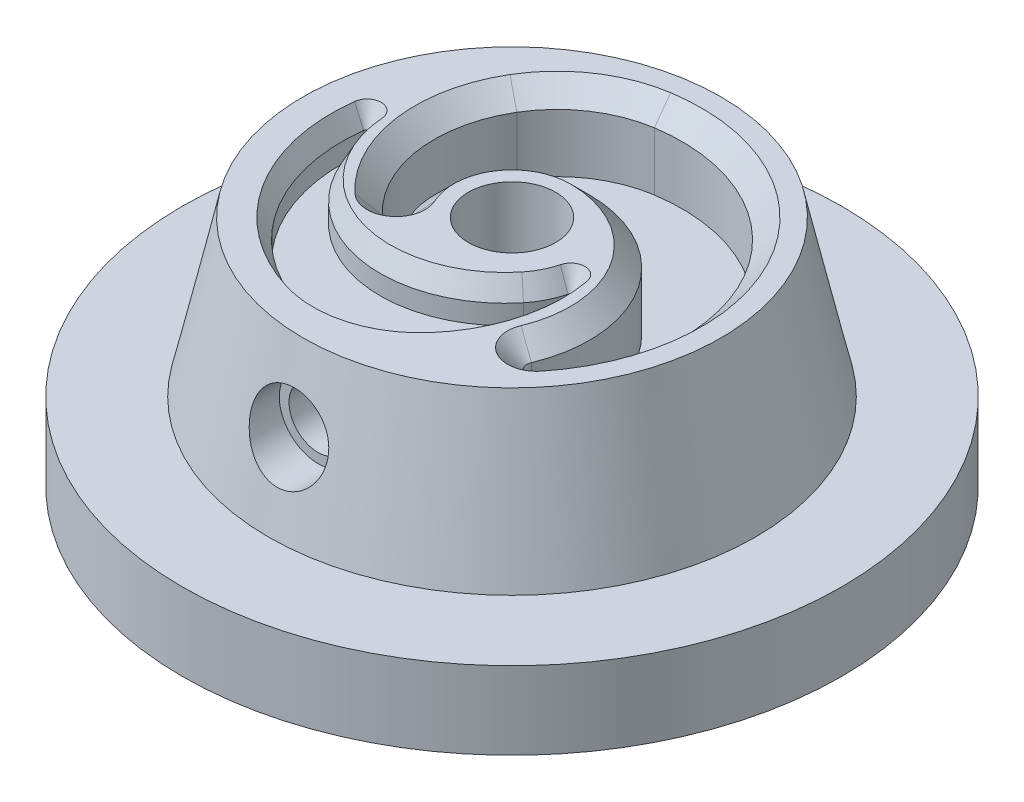
from build123d import *
from OCP.BRepFilletAPI import BRepFilletAPI_MakeChamfer

# Parameters (mm, degrees)
SKETCH1_R               = 13
BOSS_EXTRUDE1_DEPTH     = 10
SKETCH3_R               = 17
BOSS_EXTRUDE2_DEPTH     = 2
F_4_MM_SHAFT_HOLE_DEPTH = 27.870057685
BOSS_EXTRUDE3_START     = 2
SKETCH9_R               = 17
SKETCH9_R_2             = 2.25
BOSS_EXTRUDE3_DEPTH     = 2
CUT_EXTRUDE3_DEPTH      = 27.038433133
CUT_EXTRUDE4_START      = 10
SKETCH10_3_R            = 2
SKETCH10_3_R_2          = 1.5
CUT_EXTRUDE4_DEPTH      = 17.038433171
CUT_EXTRUDE5_DEPTH      = 4
FILLET3_R               = 6
FILLET4_R               = 0.5
CHAMFER1_SIZE           = 1
CUT_EXTRUDE7_DEPTH      = 2
FILLET6_R               = 5
FILLET8_R               = 0.2
CHAMFER3_SIZE           = 1
CHAMFER3_SIZE2          = 0.531709432


with BuildPart() as part:
    # Sketch1 → Boss-Extrude1 (new body)
    with BuildSketch(Plane(origin=(0, 0, 0), x_dir=(1, 0, 0), z_dir=(0, 1, 0))):
        with Locations(Location((0, 0, 0), (0, 0, 270))):
            Circle(SKETCH1_R)
    extrude(amount=BOSS_EXTRUDE1_DEPTH)

    # Sketch2 → Cut-Revolve1 (revolve, cut)
    with BuildSketch(Plane(origin=(0, 0, 0), x_dir=(0, 0, -1), z_dir=(1, 0, 0)), mode=Mode.PRIVATE) as cut_revolve1_sk:
        Polygon((-13, 0), (-10.771428571, 10), (-13, 10), align=None)
    revolve(cut_revolve1_sk.sketch.rotate(Axis((0, 0, 0), (0, 1, 0)), 180), axis=Axis((0, 0, 0), (0, 1, 0)), mode=Mode.SUBTRACT)

    # Sketch3 → Boss-Extrude2 (add)
    with BuildSketch(Plane(origin=(0, 0, 0), x_dir=(-1, 0, 0), z_dir=(0, -1, 0))):
        with Locations(Location((0, 0, 0), (0, 0, 90))):
            Circle(SKETCH3_R)
    extrude(amount=BOSS_EXTRUDE2_DEPTH)

    # Sketch5 → 4-mm shaft hole (cut, through all)
    with BuildSketch(Plane(origin=(0, 10, 0), x_dir=(1, 0, 0), z_dir=(0, 1, 0))):
        with BuildLine():
            ThreePointArc((1.677050983, 1.5), (0, 2.25), (-1.677050983, 1.5))
            Line((-1.677050983, 1.5), (1.677050983, 1.5))
        make_face()
        with BuildLine():
            Line((1.677050983, 1.5), (-1.677050983, 1.5))
            ThreePointArc((-1.677050983, 1.5), (-0.802849702, -2.101887808), (2.25, 0))
            ThreePointArc((2.25, 0), (2.101887808, 0.802849702), (1.677050983, 1.5))
        make_face()
    extrude(amount=-F_4_MM_SHAFT_HOLE_DEPTH, mode=Mode.SUBTRACT)

    # Sketch9 → Boss-Extrude3 (add)
    with BuildSketch(Plane(origin=(0, 0, 0), x_dir=(1, 0, 0), z_dir=(0, 1, 0)).offset(BOSS_EXTRUDE3_START)):
        with Locations(Location((0, 0, 0), (0, 0, 270))):
            Circle(SKETCH9_R)
        with Locations(Location((0, 0, 0), (0, 0, 270))):
            Circle(SKETCH9_R_2, mode=Mode.SUBTRACT)
    extrude(amount=-BOSS_EXTRUDE3_DEPTH)

    # Sketch10 → Cut-Extrude3 (cut, through all)
    with BuildSketch(Plane.XY):
        with BuildLine():
            ThreePointArc((0, 7.5), (-1.5, 6), (0, 4.5))
            Line((0, 4.5), (0, 7.5))
        make_face()
        with BuildLine():
            Line((0, 7.5), (0, 4.5))
            ThreePointArc((0, 4.5), (1.060660172, 4.939339828), (1.5, 6))
            ThreePointArc((1.5, 6), (1.060660172, 7.060660172), (0, 7.5))
        make_face()
    extrude(amount=CUT_EXTRUDE3_DEPTH, mode=Mode.SUBTRACT)

    # Sketch10<3> → Cut-Extrude4 (cut, through all)
    with BuildSketch(Plane.XY.offset(CUT_EXTRUDE4_START)):
        with Locations(Location((0, 6, 0), (0, 0, 225.143578884))):
            Circle(SKETCH10_3_R)
        with Locations(Location((0, 6, 0), (0, 0, 270))):
            Circle(SKETCH10_3_R_2, mode=Mode.SUBTRACT)
    extrude(amount=CUT_EXTRUDE4_DEPTH, mode=Mode.SUBTRACT)

    # Sketch11 → Cut-Extrude5 (cut)
    with BuildSketch(Plane(origin=(0, 10, 0), x_dir=(1, 0, 0), z_dir=(0, 1, 0))):
        with BuildLine():
            ThreePointArc((3, -8.242448615), (7.185132041, -5.031087033), (8.771428571, 0))
            ThreePointArc((8.771428571, 0), (5.031087033, 7.185132041), (-3, 8.242448615))
            ThreePointArc((-3, 8.242448615), (-6.302331872, 0.944417603), (0, -4))
            ThreePointArc((0, -4), (-4, 0), (0, 4))
            ThreePointArc((0, 4), (6.302331872, -0.944417603), (3, -8.242448615))
        make_face()
    extrude(amount=-CUT_EXTRUDE5_DEPTH, mode=Mode.SUBTRACT)

    # Fillet3
    fillet3_edges = [part.edges().sort_by_distance(p)[0] for p in [
        (-3, 8, -8.242448615),
    ]]
    fillet(fillet3_edges, radius=FILLET3_R)

    # Fillet4
    # the kernel refuses this fillet: 0.5 mm, written as the material it adds along each edge
    with BuildSketch(Plane(origin=(3, 10, 8.242448615), x_dir=(0.676109910174844, 0, -0.7368007799692969), z_dir=(0, -1, 0))) as fillet4_piece_1_section:
        with BuildLine():
            CenterArc((4.592297125, 0.470079575), FILLET4_R, 86.204134404, 163.874166307)
            ThreePointArc((4.625398075, 0.968982699), (2.246212442, 0.801862309), (0, 0))
            ThreePointArc((0, 0), (2.210964653, 0.38829518), (4.421929307, 0))
        make_face()
    fillet4_piece_1 = extrude(amount=15.814513008, mode=Mode.PRIVATE)
    fillet4_piece_1 = split(fillet4_piece_1, bisect_by=Plane(origin=(5.361441464, -2, 6.517574012), z_dir=(0, 1, 0)), keep=Keep.TOP, mode=Mode.PRIVATE)
    add(fillet4_piece_1)
    with BuildSketch(Plane(origin=(0, 10, 4), x_dir=(-0.8427994583990877, 0, -0.5382277147473964), z_dir=(0, -1, 0))) as fillet4_piece_2_section:
        with BuildLine():
            CenterArc((4.574935575, -0.421399729), FILLET4_R, 122.563073018, 157.850467981)
            ThreePointArc((4.665311372, -0.913164119), (2.246019142, -0.899203979), (0, 0))
            ThreePointArc((0, 0), (2.152910859, -0.628802166), (4.305821718, 0))
        make_face()
    fillet4_piece_2 = extrude(amount=14.384601093, mode=Mode.PRIVATE)
    fillet4_piece_2 = fillet4_piece_2 - Plane(origin=(0, 6, 2.911656579), x_dir=(0, 1, 0), z_dir=(0, 0, -1)) * Cylinder(1.5, 48, mode=Mode.PRIVATE)
    fillet4_piece_2 = split(fillet4_piece_2, bisect_by=Plane(origin=(-3.011239117, -2, 2.911656579), z_dir=(0, 1, 0)), keep=Keep.TOP, mode=Mode.PRIVATE)
    add(fillet4_piece_2)

    # Chamfer1
    chamfer1_edges = [part.edges().sort_by_distance(p)[0] for p in [
        (-3.371197834, 10, -2.152910859),
        (5.398969594, 10, -1.110594427),
        (-3.768481471, 10, -7.717945042),
        (7.597652385, 10, -4.383336334),
        (-6.424305098, 10, -1.576218344),
        (6.196119079, 10, 5.606673983),
        (-3.789032474, 10, 2.297570227),
    ]]
    chamfer(chamfer1_edges, length=CHAMFER1_SIZE)

    # Sketch14 → Cut-Extrude7 (cut)
    with BuildSketch(Plane(origin=(0, 10, 0), x_dir=(1, 0, 0), z_dir=(0, 1, 0))):
        with BuildLine():
            ThreePointArc((3.108583846, -2.517281564), (-5.049231929, -4.075420571), (-7.949614017, 3.706965896))
            ThreePointArc((-7.949614017, 3.706965896), (-7.397747824, -4.712885136), (0, -8.771428571))
            ThreePointArc((0, -8.771428571), (3.750591207, -5.184029494), (4, 0))
            ThreePointArc((4, 0), (3.770565964, -1.335227437), (3.108583846, -2.517281564))
        make_face()
    extrude(amount=-CUT_EXTRUDE7_DEPTH, mode=Mode.SUBTRACT)

    # Fillet6
    fillet6_edges = [part.edges().sort_by_distance(p)[0] for p in [
        (0, 9, 8.771428571),
    ]]
    fillet(fillet6_edges, radius=FILLET6_R)

    # Fillet8
    fillet8_edges = [part.edges().sort_by_distance(p)[0] for p in [
        (4, 9, 0),
        (-7.949614017, 9, -3.706965896),
    ]]
    fillet(fillet8_edges, radius=FILLET8_R)

    # Chamfer3: one chamfer whose edges measure the first distance from different faces: ONE call of the kernel's chamfer builder (chamfer() names one face for all edges)
    chamfer3_edges_1 = [part.edges().sort_by_distance(p)[0] for p in [
        (3.573698882, 10, 1.796851775),
    ]]
    chamfer3_side_1 = [part.faces().sort_by_distance(p)[0] for p in [
        (3.573698882, 9, 1.796851775),
    ]]
    chamfer3_edges_2 = [part.edges().sort_by_distance(p)[0] for p in [
        (-3.810129446, 10, 4.610453161),
    ]]
    chamfer3_side_2 = [part.faces().sort_by_distance(p)[0] for p in [
        (-3.810129446, 9, 4.610453161),
    ]]
    chamfer3_edges_3 = [part.edges().sort_by_distance(p)[0] for p in [
        (0.233729709, 10, 8.415761951),
    ]]
    chamfer3_side_3 = [part.faces().sort_by_distance(p)[0] for p in [
        (0.233729709, 9, 8.415761951),
    ]]
    chamfer3_edges_4 = [part.edges().sort_by_distance(p)[0] for p in [
        (-7.362823163, 10, 4.767262763),
    ]]
    chamfer3_side_4 = [part.faces().sort_by_distance(p)[0] for p in [
        (-7.362823163, 9, 4.767262763),
    ]]
    chamfer3_edges_5 = [part.edges().sort_by_distance(p)[0] for p in [
        (4.128369515, 10, 4.145305416),
    ]]
    chamfer3_side_5 = [part.faces().sort_by_distance(p)[0] for p in [
        (4.128369515, 9, 4.145305416),
    ]]
    chamfer3_edges_6 = [part.edges().sort_by_distance(p)[0] for p in [
        (-8.504611001, 10, -1.231596345),
    ]]
    chamfer3_side_6 = [part.faces().sort_by_distance(p)[0] for p in [
        (-8.504611001, 9, -1.231596345),
    ]]
    chamfer3_edges_7 = [part.edges().sort_by_distance(p)[0] for p in [
        (4.075125782, 10, 0.843648275),
    ]]
    chamfer3_side_7 = [part.faces().sort_by_distance(p)[0] for p in [
        (4.075125783, 9, 0.843648274),
    ]]
    chamfer3 = BRepFilletAPI_MakeChamfer(part.part.solid().wrapped)
    for e in chamfer3_edges_1:
        chamfer3.Add(CHAMFER3_SIZE, CHAMFER3_SIZE2, e.wrapped, chamfer3_side_1[0].wrapped)  # the first distance lies on this face
    for e in chamfer3_edges_2:
        chamfer3.Add(CHAMFER3_SIZE, CHAMFER3_SIZE2, e.wrapped, chamfer3_side_2[0].wrapped)  # the first distance lies on this face
    for e in chamfer3_edges_3:
        chamfer3.Add(CHAMFER3_SIZE, CHAMFER3_SIZE2, e.wrapped, chamfer3_side_3[0].wrapped)  # the first distance lies on this face
    for e in chamfer3_edges_4:
        chamfer3.Add(CHAMFER3_SIZE, CHAMFER3_SIZE2, e.wrapped, chamfer3_side_4[0].wrapped)  # the first distance lies on this face
    for e in chamfer3_edges_5:
        chamfer3.Add(CHAMFER3_SIZE, CHAMFER3_SIZE2, e.wrapped, chamfer3_side_5[0].wrapped)  # the first distance lies on this face
    for e in chamfer3_edges_6:
        chamfer3.Add(CHAMFER3_SIZE, CHAMFER3_SIZE2, e.wrapped, chamfer3_side_6[0].wrapped)  # the first distance lies on this face
    for e in chamfer3_edges_7:
        chamfer3.Add(CHAMFER3_SIZE, CHAMFER3_SIZE2, e.wrapped, chamfer3_side_7[0].wrapped)  # the first distance lies on this face
    add(Compound.cast(chamfer3.Shape()), mode=Mode.REPLACE)


solid = part.part
